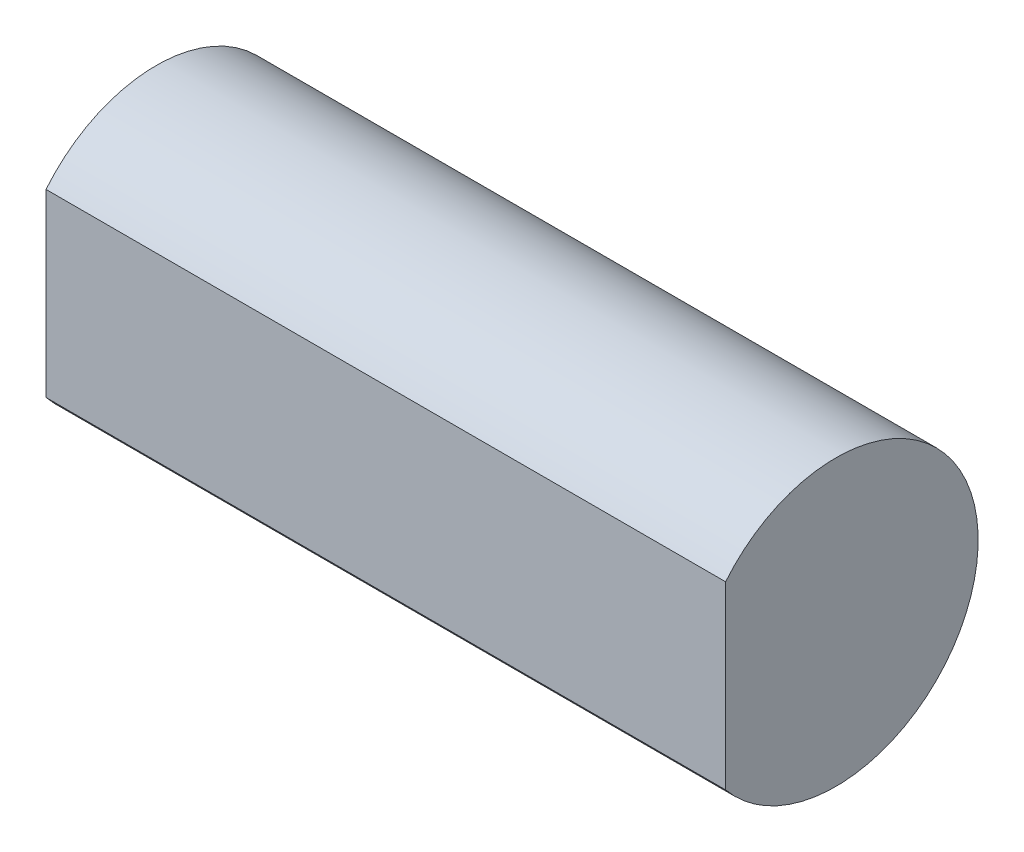
from build123d import *

# Parameters (mm, degrees)
SALIENTE_EXTRUIR1_DEPTH = 18.5


with BuildPart() as part:
    # Croquis1 → Saliente-Extruir1 (new body)
    with BuildSketch(Plane.YZ):
        with BuildLine():
            ThreePointArc((-2.452677109, 3), (0, -3.875), (2.452677109, 3))
            Line((2.452677109, 3), (-2.452677109, 3))
        make_face()
    extrude(amount=SALIENTE_EXTRUIR1_DEPTH)


solid = part.part
